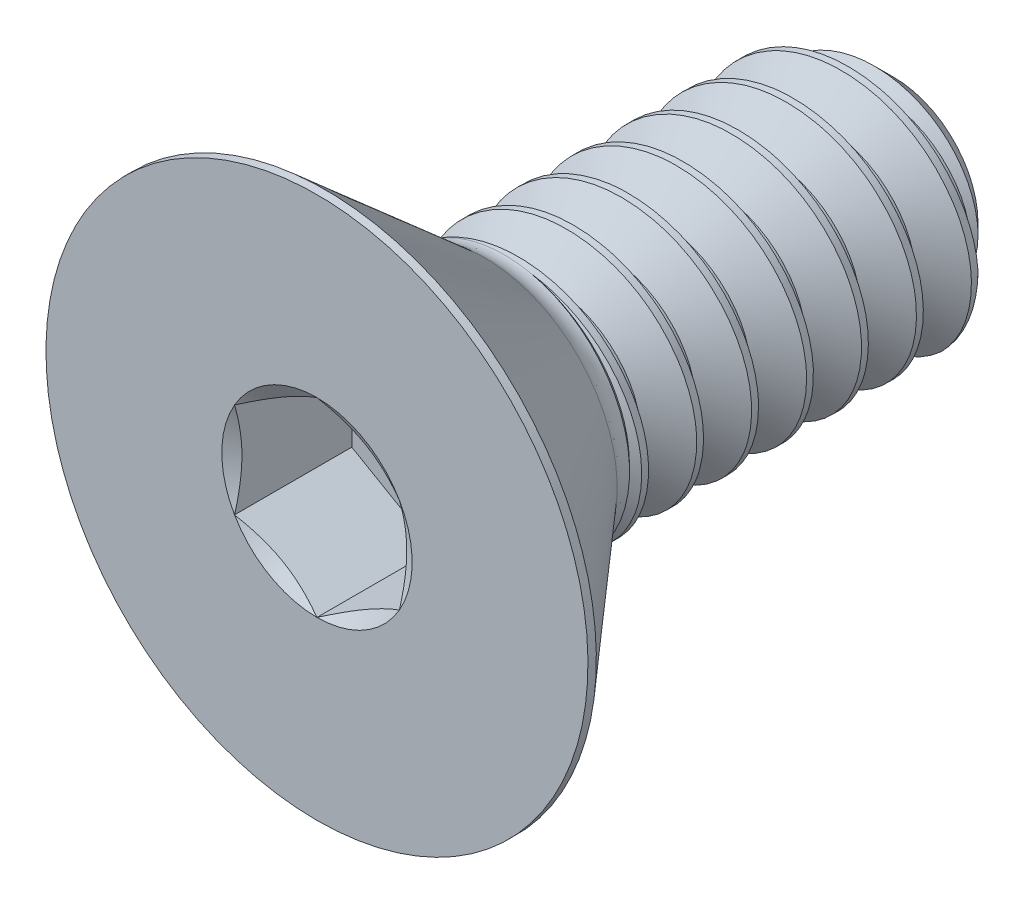
from build123d import *
from build123d.topology import SkipClean

# Parameters (mm, degrees)
SKETCH1_W          = 11.1125
SKETCH1_H          = 2.413
CHAMFER1_SIZE      = 0.79375
CUT_SWEEP1_PITCH   = 1.058333333
CUT_EXTRUDE2_DEPTH = 2.25806


with BuildPart() as part:
    # Sketch1 → Revolve1 (revolve)
    with BuildSketch(Plane(origin=(0, 0, 0), x_dir=(0, 0, -1), z_dir=(1, 0, 0)), mode=Mode.PRIVATE) as revolve1_sk:
        with Locations((5.55625, 1.2065)):
            Rectangle(SKETCH1_W, SKETCH1_H)
    revolve(revolve1_sk.sketch.rotate(Axis((0, 0, -11.1125), (0, 0, 1)), 90), axis=Axis((0, 0, -11.1125), (0, 0, 1)))

    # Chamfer1
    chamfer1_edges = [part.edges().sort_by_distance(p)[0] for p in [
        (2.413, 0, -11.1125),
    ]]
    chamfer(chamfer1_edges, length=CHAMFER1_SIZE)

    # Cut-Sweep1: the profile of Sketch2 profile screwed along a right-hand helix of 10.5 turns, 8 arcs to a turn; built about Z, then put on its axis
    with SkipClean():  # the faces are left unmerged after this step: merging them gives an invalid solid
        cut_sweep1_z = Axis((0, 0, 0), (0, 0, 1))
        cut_sweep1_corners = [(2.4136, 0, 0.00034641), (2.4136, 0, -0.926388077), (1.725592336, 0, -0.529166667), (1.725592336, 0, -0.396875)]
        with BuildLine(mode=Mode.PRIVATE) as cut_sweep1_profile:
            Line(cut_sweep1_corners[0], cut_sweep1_corners[1])
            Line(cut_sweep1_corners[1], cut_sweep1_corners[2])
            Line(cut_sweep1_corners[2], cut_sweep1_corners[3])
            Line(cut_sweep1_corners[3], cut_sweep1_corners[0])
        cut_sweep1_cap = Face(cut_sweep1_profile.wire())
        cut_sweep1_turn_angles = [0, 22.5, 45, 67.5, 90, 112.5, 135, 157.5, 180, 202.5, 225, 247.5, 270, 292.5, 315, 337.5, 360]
        cut_sweep1_turn_weights = [1, 0.9238795325112867, 1, 0.9238795325112867, 1, 0.9238795325112867, 1, 0.9238795325112867, 1, 0.9238795325112867, 1, 0.9238795325112867, 1, 0.9238795325112867, 1, 0.9238795325112867, 1]
        cut_sweep1_turn_rails = [Edge.make_bspline([Vector(p[0], p[1], 0).rotate(cut_sweep1_z, cut_sweep1_turn_angles[k]) / cut_sweep1_turn_weights[k] + Vector(0, 0, p[2] + CUT_SWEEP1_PITCH * cut_sweep1_turn_angles[k] / 360) for k in range(17)], [0, 0, 0, 1, 1, 2, 2, 3, 3, 4, 4, 5, 5, 6, 6, 7, 7, 8, 8, 8], 2, cut_sweep1_turn_weights) for p in cut_sweep1_corners]
        cut_sweep1_turn_sides = [Face.make_surface_from_curves(cut_sweep1_turn_rails[p[0]], cut_sweep1_turn_rails[p[1]]) for p in [(0, 1), (1, 2), (2, 3), (3, 0)]]
        cut_sweep1_last_angles = [3600, 3622.5, 3645, 3667.5, 3690, 3712.5, 3735, 3757.5, 3780]
        cut_sweep1_last_weights = [1, 0.9238795325112867, 1, 0.9238795325112867, 1, 0.9238795325112867, 1, 0.9238795325112822, 1]
        cut_sweep1_last_rails = [Edge.make_bspline([Vector(p[0], p[1], 0).rotate(cut_sweep1_z, cut_sweep1_last_angles[k]) / cut_sweep1_last_weights[k] + Vector(0, 0, p[2] + CUT_SWEEP1_PITCH * cut_sweep1_last_angles[k] / 360) for k in range(9)], [0, 0, 0, 1, 1, 2, 2, 3, 3, 4, 4, 4], 2, cut_sweep1_last_weights) for p in cut_sweep1_corners]
        cut_sweep1_last_sides = [Face.make_surface_from_curves(cut_sweep1_last_rails[p[0]], cut_sweep1_last_rails[p[1]]) for p in [(0, 1), (1, 2), (2, 3), (3, 0)]]
        cut_sweep1 = Plane(origin=(0, 0, -11.1125), x_dir=(0, 1, 0), z_dir=(0, 0, 1)) * Solid(Shell([*[p.moved(Location((0, 0, CUT_SWEEP1_PITCH * i))) for i in range(10) for p in cut_sweep1_turn_sides], *cut_sweep1_last_sides, cut_sweep1_cap, cut_sweep1_cap.rotate(cut_sweep1_z, 3780).moved(Location((0, 0, CUT_SWEEP1_PITCH * 3780 / 360)))]))
        add(cut_sweep1, mode=Mode.SUBTRACT)

    # Sketch7 → Revolve2 (revolve)
    with BuildSketch(Plane(origin=(0, 0, 0), x_dir=(0, 0, -1), z_dir=(1, 0, 0)), mode=Mode.PRIVATE) as revolve2_sk:
        with BuildLine():
            Line((0, 5.2197), (0.16129, 5.2197))
            Line((0.16129, 5.2197), (3.2258, 2.555762099))
            ThreePointArc((3.2258, 2.555762099), (3.403809493, 2.44985758), (3.607634579, 2.413))
            Line((3.607634579, 2.413), (3.607634579, 0))
            Line((3.607634579, 0), (0, 0))
            Line((0, 0), (0, 5.2197))
        make_face()
    revolve(revolve2_sk.sketch.rotate(Axis((0, 0, 0), (0, 0, -1)), 180), axis=Axis((0, 0, 0), (0, 0, -1)))

    # Boss-Extrude1 cone 1 section (through the dimple's axis) → Boss-Extrude1 (revolve)
    with BuildSketch(Plane(origin=(0, 0, -3.607634579), x_dir=(0, -1, 0), z_dir=(1, 0, 0))):
        Polygon((0, 0), (2.413, 0), (0, 2.330207014), align=None)
    revolve(axis=Axis((0, 0, -3.607634579), (0, 0, -1)))

    # Sketch5 → Cut-Extrude2 (cut)
    with BuildSketch(Plane.XY):
        Polygon((0, 1.833087105), (-1.5875, 0.916543552), (-1.5875, -0.916543552), (0, -1.833087105), (1.5875, -0.916543552), (1.5875, 0.916543552), align=None)
    extrude(amount=-CUT_EXTRUDE2_DEPTH, mode=Mode.SUBTRACT)

    # Cut-Extrude3 cone 1 section (through the dimple's axis) → Cut-Extrude3 (revolve, cut)
    with BuildSketch(Plane(origin=(0, 0, 0), x_dir=(0, -1, 0), z_dir=(1, 0, 0))):
        Polygon((0, 0), (1.833087105, 0), (0, 1.058333333), align=None)
    revolve(axis=Axis((0, 0, 0), (0, 0, -1)), mode=Mode.SUBTRACT)


solid = part.part
